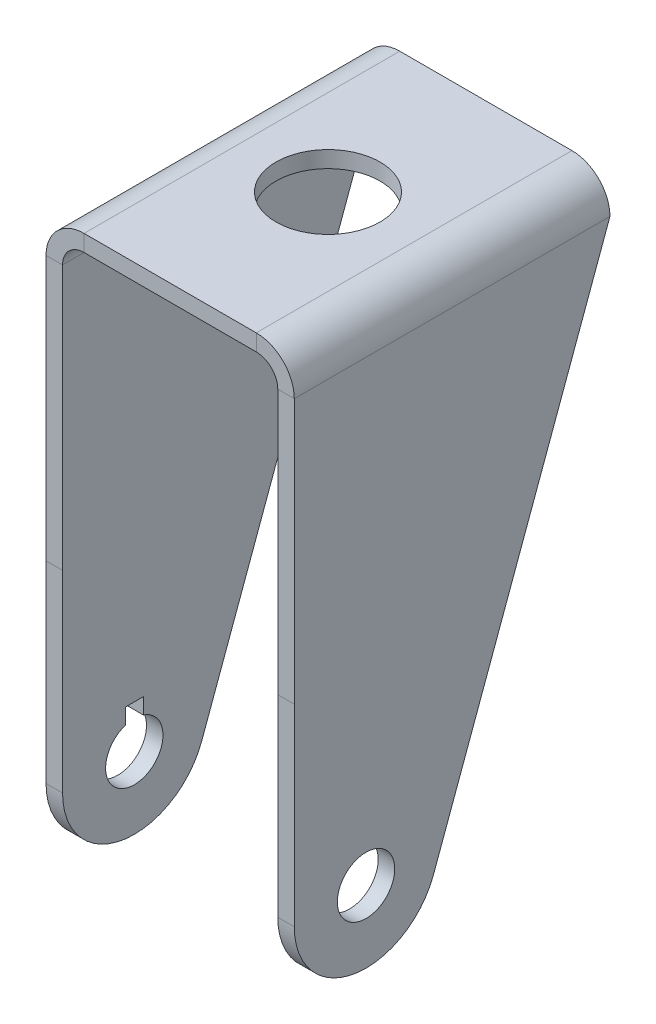
from build123d import *

# Parameters (mm, degrees)
BASE_FLANGE1_DEPTH      = 44
CUT_EXTRUDE1_DEPTH      = 57
CUT_EXTRUDE1_DEPTH_BACK = 42
SKETCH7_R               = 4
CUT_EXTRUDE2_DEPTH      = 42
SKETCH8_R               = 7.25
CUT_EXTRUDE3_DEPTH      = 42
SKETCH9_W               = 2.5
SKETCH9_H               = 6
CUT_EXTRUDE4_DEPTH      = 13


# Sheet-metal steps are written as plain solids
with BuildPart() as part:
    # Sketch1 → Base-Flange1 (new body)
    with BuildSketch(Plane.XY):
        with BuildLine():
            Line((15, 0), (15, 73.75))
            ThreePointArc((15, 73.75), (14.121320344, 75.871320344), (12, 76.75))
            Line((12, 76.75), (-12, 76.75))
            ThreePointArc((-12, 76.75), (-14.121320344, 75.871320344), (-15, 73.75))
            Line((-15, 73.75), (-15, 0))
            Line((-15, 0), (-17.3, 0))
            Line((-17.3, 0), (-17.3, 73.75))
            ThreePointArc((-17.3, 73.75), (-15.74766594, 77.49766594), (-12, 79.05))
            Line((-12, 79.05), (12, 79.05))
            ThreePointArc((12, 79.05), (15.74766594, 77.49766594), (17.3, 73.75))
            Line((17.3, 73.75), (17.3, 0))
            Line((17.3, 0), (15, 0))
        make_face()
    extrude(amount=BASE_FLANGE1_DEPTH)

    # Sketch6 → Cut-Extrude1 (cut, two sides: drawn at the far end of the back side and taken through both)
    with BuildSketch(Plane(origin=(0, 0, 0), x_dir=(0, 0, -1), z_dir=(1, 0, 0)).offset(-CUT_EXTRUDE1_DEPTH_BACK)):
        with BuildLine():
            Line((0, 73.75), (-24.610061631, 6.560660321))
            ThreePointArc((-24.610061631, 6.560660321), (-35.746513142, 0.153696539), (-44, 10))
            Line((-44, 10), (-44, 36.875))
            Line((-44, 36.875), (-75.735832134, 36.875))
            Line((-75.735832134, 36.875), (-75.735832134, -15.470238138))
            Line((-75.735832134, -15.470238138), (20.414497878, -15.470238138))
            Line((20.414497878, -15.470238138), (20.414497878, 73.75))
            Line((20.414497878, 73.75), (0, 73.75))
        make_face()
    extrude(amount=CUT_EXTRUDE1_DEPTH + CUT_EXTRUDE1_DEPTH_BACK, mode=Mode.SUBTRACT)

    # Sketch7 → Cut-Extrude2 (cut)
    with BuildSketch(Plane(origin=(17.3, 0, 0), x_dir=(0, 0, -1), z_dir=(1, 0, 0))):
        with Locations(Location((-34, 10, 0), (0, 0, 90))):
            Circle(SKETCH7_R)
    extrude(amount=-CUT_EXTRUDE2_DEPTH, mode=Mode.SUBTRACT)

    # Sketch8 → Cut-Extrude3 (cut)
    with BuildSketch(Plane(origin=(0, 79.05, 0), x_dir=(1, 0, 0), z_dir=(0, 1, 0))):
        with Locations(Location((0, -22, 0), (0, 0, 270))):
            Circle(SKETCH8_R)
    extrude(amount=-CUT_EXTRUDE3_DEPTH, mode=Mode.SUBTRACT)

    # Sketch9 → Cut-Extrude4 (cut)
    with BuildSketch(Plane.ZY.offset(17.3)):
        with Locations((34, 13)):
            Rectangle(SKETCH9_W, SKETCH9_H)
    extrude(amount=-CUT_EXTRUDE4_DEPTH, mode=Mode.SUBTRACT)


solid = part.part
